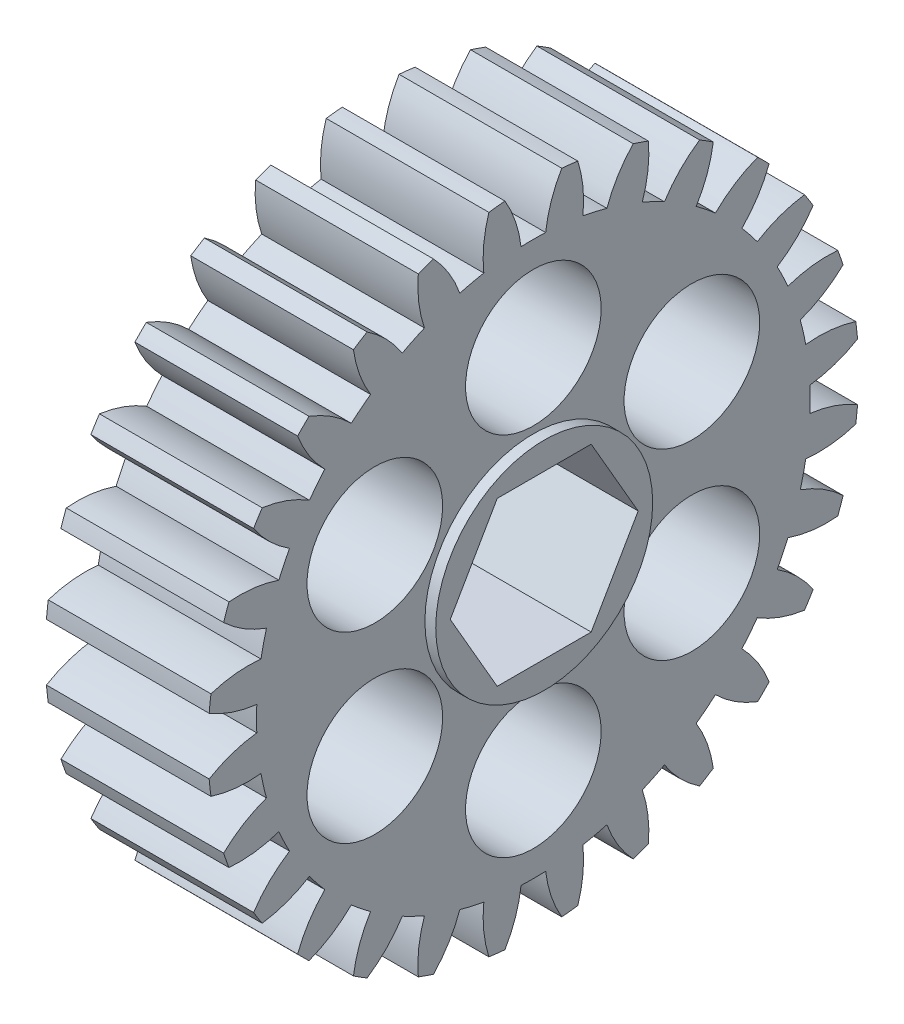
from build123d import *

# Parameters (mm, degrees)
SPUR_START             = -42.481927808
SPUR_GEAR_AI_OUTLINE_R = 4.7625
SPUR_GEAR_AI_DEPTH     = 9.525
CUT_EXTRUDE1_DEPTH     = 46.931097123
SKETCH2_R              = 6.35
BOSS_EXTRUDE1_DEPTH    = 0.635
SKETCH3_R              = 3.96875
CUT_EXTRUDE2_DEPTH     = 46.931097123


# Read off the part's stored shape, not the designer's step: spur gear_ai
with BuildPart() as part:
    # spur gear_ai outline → spur gear_ai (new body)
    with BuildSketch(Plane.YZ.offset(SPUR_START)):
        with BuildLine():
            ThreePointArc((25.394416331, 10.535709879), (25.555763503, 10.979120325), (25.706079095, 11.426390888))
            ThreePointArc((25.706079095, 11.426390888), (24.532461705, 12.327493349), (23.197787121, 12.966247744))
            ThreePointArc((23.197787121, 12.966247744), (23.373687863, 13.664940216), (23.518358073, 14.370760854))
            ThreePointArc((23.518358073, 14.370760854), (24.998003468, 14.367165078), (26.446369904, 14.669816842))
            ThreePointArc((26.446369904, 14.669816842), (26.505003659, 15.138013186), (26.552023462, 15.607518108))
            ThreePointArc((26.552023462, 15.607518108), (25.207316949, 16.224873611), (23.763969219, 16.550620065))
            ThreePointArc((23.763969219, 16.550620065), (23.77998606, 17.270936455), (23.763969219, 17.991252846))
            ThreePointArc((23.763969219, 17.991252846), (25.207316949, 18.316999299), (26.552023462, 18.934354803))
            ThreePointArc((26.552023462, 18.934354803), (26.505003659, 19.403859725), (26.446369904, 19.872056069))
            ThreePointArc((26.446369904, 19.872056069), (24.998003468, 20.174707832), (23.518358073, 20.171112057))
            ThreePointArc((23.518358073, 20.171112057), (23.373687863, 20.876932695), (23.197787121, 21.575625167))
            ThreePointArc((23.197787121, 21.575625167), (24.532461706, 22.214379561), (25.706079095, 23.115482023))
            ThreePointArc((25.706079095, 23.115482023), (25.555763503, 23.562752586), (25.394416331, 24.006163032))
            ThreePointArc((25.394416331, 24.006163032), (23.915017112, 23.978934831), (22.473269652, 23.646177134))
            ThreePointArc((22.473269652, 23.646177134), (22.175166759, 24.302109224), (21.848202514, 24.94414242))
            ThreePointArc((21.848202514, 24.94414242), (23.007277796, 25.863874944), (23.950955986, 27.003539323))
            ThreePointArc((23.950955986, 27.003539323), (23.704882056, 27.406147513), (23.448912087, 27.80253761))
            ThreePointArc((23.448912087, 27.80253761), (22.01266334, 27.446794781), (20.681109053, 26.801561023))
            ThreePointArc((20.681109053, 26.801561023), (20.2445216, 27.374713392), (19.782889205, 27.927893087))
            ThreePointArc((19.782889205, 27.927893087), (20.70824431, 29.08248451), (21.374663335, 30.403563276))
            ThreePointArc((21.374663335, 30.403563276), (21.045170242, 30.741320637), (20.707412881, 31.07081373))
            ThreePointArc((20.707412881, 31.07081373), (19.386334115, 30.404394705), (18.231742692, 29.4790396))
            ThreePointArc((18.231742692, 29.4790396), (17.678562998, 29.940671995), (17.105410629, 30.377259448))
            ThreePointArc((17.105410629, 30.377259448), (17.750644387, 31.708813735), (18.106387215, 33.145062482))
            ThreePointArc((18.106387215, 33.145062482), (17.709997118, 33.401032451), (17.307388928, 33.647106381))
            ThreePointArc((17.307388928, 33.647106381), (16.167724549, 32.703428191), (15.247992026, 31.544352909))
            ThreePointArc((15.247992026, 31.544352909), (14.605958829, 31.871317153), (13.950026739, 32.169420047))
            ThreePointArc((13.950026739, 32.169420047), (14.282784436, 33.611167507), (14.310012637, 35.090566726))
            ThreePointArc((14.310012637, 35.090566726), (13.866602191, 35.251913898), (13.419331628, 35.40222949))
            ThreePointArc((13.419331628, 35.40222949), (12.518229166, 34.228612101), (11.879474772, 32.893937516))
            ThreePointArc((11.879474772, 32.893937516), (11.1807823, 33.069838258), (10.474961662, 33.214508468))
            ThreePointArc((10.474961662, 33.214508468), (10.478557437, 34.694153863), (10.175905674, 36.142520299))
            ThreePointArc((10.175905674, 36.142520299), (9.70770933, 36.201154054), (9.238204408, 36.248173857))
            ThreePointArc((9.238204408, 36.248173857), (8.620848904, 34.903467344), (8.295102451, 33.460119614))
            ThreePointArc((8.295102451, 33.460119614), (7.574786061, 33.476136455), (6.85446967, 33.460119614))
            ThreePointArc((6.85446967, 33.460119614), (6.528723216, 34.903467344), (5.911367713, 36.248173857))
            ThreePointArc((5.911367713, 36.248173857), (5.441862791, 36.201154054), (4.973666447, 36.142520299))
            ThreePointArc((4.973666447, 36.142520299), (4.671014684, 34.694153863), (4.674610459, 33.214508468))
            ThreePointArc((4.674610459, 33.214508468), (3.968789821, 33.069838258), (3.270097349, 32.893937516))
            ThreePointArc((3.270097349, 32.893937516), (2.631342954, 34.2286121), (1.730240493, 35.40222949))
            ThreePointArc((1.730240493, 35.40222949), (1.28296993, 35.251913898), (0.839559484, 35.090566726))
            ThreePointArc((0.839559484, 35.090566726), (0.866787685, 33.611167507), (1.199545381, 32.169420047))
            ThreePointArc((1.199545381, 32.169420047), (0.543613291, 31.871317153), (-0.098419905, 31.544352909))
            ThreePointArc((-0.098419905, 31.544352909), (-1.018152428, 32.703428191), (-2.157816807, 33.647106381))
            ThreePointArc((-2.157816807, 33.647106381), (-2.560424997, 33.401032451), (-2.956815094, 33.145062482))
            ThreePointArc((-2.956815094, 33.145062482), (-2.601072266, 31.708813735), (-1.955838508, 30.377259448))
            ThreePointArc((-1.955838508, 30.377259448), (-2.528990877, 29.940671995), (-3.082170571, 29.4790396))
            ThreePointArc((-3.082170571, 29.4790396), (-4.236761994, 30.404394705), (-5.55784076, 31.07081373))
            ThreePointArc((-5.55784076, 31.07081373), (-5.895598121, 30.741320637), (-6.225091214, 30.403563276))
            ThreePointArc((-6.225091214, 30.403563276), (-5.558672189, 29.08248451), (-4.633317085, 27.927893087))
            ThreePointArc((-4.633317085, 27.927893087), (-5.094949479, 27.374713392), (-5.531536932, 26.801561023))
            ThreePointArc((-5.531536932, 26.801561023), (-6.86309122, 27.446794781), (-8.299339967, 27.80253761))
            ThreePointArc((-8.299339967, 27.80253761), (-8.555309935, 27.406147513), (-8.801383865, 27.003539323))
            ThreePointArc((-8.801383865, 27.003539323), (-7.857705675, 25.863874944), (-6.698630393, 24.94414242))
            ThreePointArc((-6.698630393, 24.94414242), (-7.025594638, 24.302109224), (-7.323697531, 23.646177134))
            ThreePointArc((-7.323697531, 23.646177134), (-8.765444991, 23.978934831), (-10.24484421, 24.006163032))
            ThreePointArc((-10.24484421, 24.006163032), (-10.406191382, 23.562752586), (-10.556506974, 23.115482023))
            ThreePointArc((-10.556506974, 23.115482023), (-9.382889585, 22.214379561), (-8.048215, 21.575625167))
            ThreePointArc((-8.048215, 21.575625167), (-8.224115742, 20.876932695), (-8.368785952, 20.171112057))
            ThreePointArc((-8.368785952, 20.171112057), (-9.848431347, 20.174707832), (-11.296797783, 19.872056069))
            ThreePointArc((-11.296797783, 19.872056069), (-11.355431538, 19.403859725), (-11.402451341, 18.934354803))
            ThreePointArc((-11.402451341, 18.934354803), (-10.057744829, 18.316999299), (-8.614397098, 17.991252846))
            ThreePointArc((-8.614397098, 17.991252846), (-8.63041394, 17.270936455), (-8.614397098, 16.550620065))
            ThreePointArc((-8.614397098, 16.550620065), (-10.057744828, 16.224873611), (-11.402451341, 15.607518108))
            ThreePointArc((-11.402451341, 15.607518108), (-11.355431538, 15.138013186), (-11.296797783, 14.669816842))
            ThreePointArc((-11.296797783, 14.669816842), (-9.848431347, 14.367165078), (-8.368785952, 14.370760854))
            ThreePointArc((-8.368785952, 14.370760854), (-8.224115742, 13.664940216), (-8.048215, 12.966247744))
            ThreePointArc((-8.048215, 12.966247744), (-9.382889584, 12.327493349), (-10.556506974, 11.426390888))
            ThreePointArc((-10.556506974, 11.426390888), (-10.406191382, 10.979120325), (-10.24484421, 10.535709879))
            ThreePointArc((-10.24484421, 10.535709879), (-8.765444991, 10.562938079), (-7.323697531, 10.895695776))
            ThreePointArc((-7.323697531, 10.895695776), (-7.025594638, 10.239763686), (-6.698630393, 9.59773049))
            ThreePointArc((-6.698630393, 9.59773049), (-7.857705675, 8.677997967), (-8.801383865, 7.538333588))
            ThreePointArc((-8.801383865, 7.538333588), (-8.555309935, 7.135725398), (-8.299339967, 6.739335301))
            ThreePointArc((-8.299339967, 6.739335301), (-6.86309122, 7.095078129), (-5.531536932, 7.740311887))
            ThreePointArc((-5.531536932, 7.740311887), (-5.094949479, 7.167159518), (-4.633317085, 6.613979824))
            ThreePointArc((-4.633317085, 6.613979824), (-5.558672189, 5.459388401), (-6.225091214, 4.138309635))
            ThreePointArc((-6.225091214, 4.138309635), (-5.895598121, 3.800552274), (-5.55784076, 3.471059181))
            ThreePointArc((-5.55784076, 3.471059181), (-4.236761994, 4.137478206), (-3.082170571, 5.06283331))
            ThreePointArc((-3.082170571, 5.06283331), (-2.528990877, 4.601200916), (-1.955838508, 4.164613463))
            ThreePointArc((-1.955838508, 4.164613463), (-2.601072266, 2.833059175), (-2.956815094, 1.396810428))
            ThreePointArc((-2.956815094, 1.396810428), (-2.560424997, 1.14084046), (-2.157816807, 0.89476653))
            ThreePointArc((-2.157816807, 0.89476653), (-1.018152428, 1.83844472), (-0.098419905, 2.997520002))
            ThreePointArc((-0.098419905, 2.997520002), (0.543613291, 2.670555757), (1.199545381, 2.372452864))
            ThreePointArc((1.199545381, 2.372452864), (0.866787685, 0.930705404), (0.839559484, -0.548693815))
            ThreePointArc((0.839559484, -0.548693815), (1.28296993, -0.710040987), (1.730240493, -0.860356579))
            ThreePointArc((1.730240493, -0.860356579), (2.631342954, 0.313260811), (3.270097349, 1.647935395))
            ThreePointArc((3.270097349, 1.647935395), (3.968789821, 1.472034653), (4.674610459, 1.327364443))
            ThreePointArc((4.674610459, 1.327364443), (4.671014684, -0.152280952), (4.973666447, -1.600647388))
            ThreePointArc((4.973666447, -1.600647388), (5.441862791, -1.659281143), (5.911367713, -1.706300946))
            ThreePointArc((5.911367713, -1.706300946), (6.528723216, -0.361594433), (6.85446967, 1.081753297))
            ThreePointArc((6.85446967, 1.081753297), (7.574786061, 1.065736455), (8.295102451, 1.081753297))
            ThreePointArc((8.295102451, 1.081753297), (8.620848904, -0.361594434), (9.238204408, -1.706300946))
            ThreePointArc((9.238204408, -1.706300946), (9.70770933, -1.659281143), (10.175905674, -1.600647388))
            ThreePointArc((10.175905674, -1.600647388), (10.478557437, -0.152280952), (10.474961662, 1.327364443))
            ThreePointArc((10.474961662, 1.327364443), (11.1807823, 1.472034653), (11.879474772, 1.647935395))
            ThreePointArc((11.879474772, 1.647935395), (12.518229166, 0.31326081), (13.419331628, -0.860356579))
            ThreePointArc((13.419331628, -0.860356579), (13.866602191, -0.710040987), (14.310012637, -0.548693815))
            ThreePointArc((14.310012637, -0.548693815), (14.282784436, 0.930705404), (13.950026739, 2.372452864))
            ThreePointArc((13.950026739, 2.372452864), (14.60595883, 2.670555757), (15.247992026, 2.997520002))
            ThreePointArc((15.247992026, 2.997520002), (16.167724549, 1.83844472), (17.307388928, 0.89476653))
            ThreePointArc((17.307388928, 0.89476653), (17.709997118, 1.14084046), (18.106387215, 1.396810428))
            ThreePointArc((18.106387215, 1.396810428), (17.750644387, 2.833059175), (17.105410629, 4.164613463))
            ThreePointArc((17.105410629, 4.164613463), (17.678562998, 4.601200916), (18.231742692, 5.06283331))
            ThreePointArc((18.231742692, 5.06283331), (19.386334115, 4.137478206), (20.707412881, 3.471059181))
            ThreePointArc((20.707412881, 3.471059181), (21.045170242, 3.800552274), (21.374663335, 4.138309635))
            ThreePointArc((21.374663335, 4.138309635), (20.70824431, 5.459388401), (19.782889205, 6.613979824))
            ThreePointArc((19.782889205, 6.613979824), (20.2445216, 7.167159518), (20.681109053, 7.740311887))
            ThreePointArc((20.681109053, 7.740311887), (22.01266334, 7.095078129), (23.448912087, 6.739335301))
            ThreePointArc((23.448912087, 6.739335301), (23.704882056, 7.135725398), (23.950955986, 7.538333588))
            ThreePointArc((23.950955986, 7.538333588), (23.007277796, 8.677997967), (21.848202514, 9.59773049))
            ThreePointArc((21.848202514, 9.59773049), (22.175166759, 10.239763686), (22.473269652, 10.895695776))
            ThreePointArc((22.473269652, 10.895695776), (23.915017112, 10.562938079), (25.394416331, 10.535709879))
        make_face()
        with Locations((7.57478606, 17.270936455)):
            Circle(SPUR_GEAR_AI_OUTLINE_R, mode=Mode.SUBTRACT)
    extrude(amount=SPUR_GEAR_AI_DEPTH)

    # Sketch1 → Cut-Extrude1 (cut, through all)
    with BuildSketch(Plane(origin=(-32.956927808, 0, 0), x_dir=(0, 0, -1), z_dir=(1, 0, 0))):
        Polygon((-14.521305798, 12.33728606), (-20.020567112, 12.33728606), (-22.770197769, 7.57478606), (-20.020567112, 2.81228606), (-14.521305798, 2.81228606), (-11.771675141, 7.57478606), align=None)
    extrude(amount=-CUT_EXTRUDE1_DEPTH, mode=Mode.SUBTRACT)

    # Sketch2 → Boss-Extrude1 (add)
    with BuildSketch(Plane(origin=(-32.956927808, 0, 0), x_dir=(0, 0, -1), z_dir=(1, 0, 0))):
        with Locations(Location((-17.270936455, 7.57478606, 0), (0, 0, 180))):
            Circle(SKETCH2_R)
        Polygon((-14.521305798, 12.33728606), (-20.020567112, 12.33728606), (-22.770197769, 7.57478606), (-20.020567112, 2.81228606), (-14.521305798, 2.81228606), (-11.771675141, 7.57478606), align=None, mode=Mode.SUBTRACT)
    extrude(amount=BOSS_EXTRUDE1_DEPTH)

    # Sketch3 → Cut-Extrude2 (cut, through all)
    with BuildSketch(Plane(origin=(-32.956927808, 0, 0), x_dir=(0, 0, -1), z_dir=(1, 0, 0))):
        with Locations((-17.270936455, 18.29041106)):
            Circle(SKETCH3_R)
        with Locations((-7.990932988, 12.93259856)):
            Circle(SKETCH3_R)
        with Locations((-7.990932988, 2.21697356)):
            Circle(SKETCH3_R)
        with Locations((-17.270936455, -3.14083894)):
            Circle(SKETCH3_R)
        with Locations((-26.550939923, 2.21697356)):
            Circle(SKETCH3_R)
        with Locations((-26.550939923, 12.93259856)):
            Circle(SKETCH3_R)
    extrude(amount=-CUT_EXTRUDE2_DEPTH, mode=Mode.SUBTRACT)


solid = part.part
